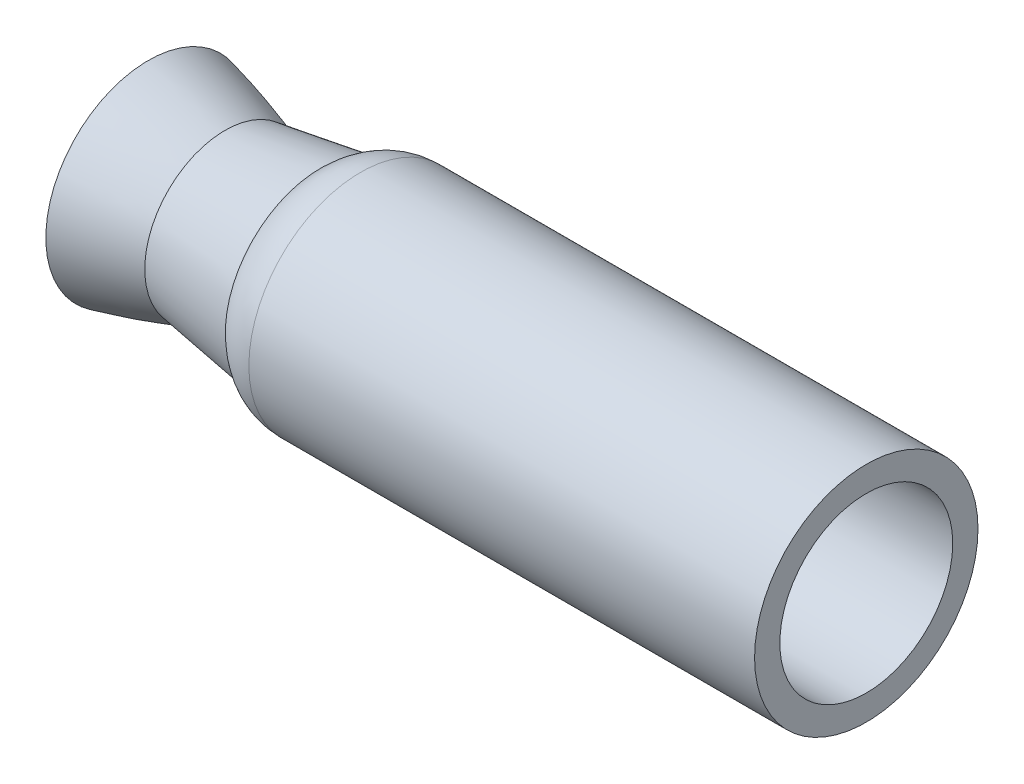
from build123d import *


with BuildPart() as part:
    # Sketch1 → Revolve1 (revolve)
    with BuildSketch(Plane.XY):
        with BuildLine():
            Line((28.949236933, 27.386004017), (189.133015331, 27.386004017))
            Line((189.133015331, 27.386004017), (189.133015331, 35.386004017))
            Line((189.133015331, 35.386004017), (28.949236933, 35.386004017))
            ThreePointArc((28.949236933, 35.386004017), (22.060935151, 34.015835602), (16.221314872, 30.113926078))
            Line((16.221314872, 30.113926078), (-13.981586934, 25.437652311))
            add(Edge.make_bspline(
                [(-13.981586934, 25.437652311), (-16.029314719, 26.139512712), (-28.160190772, 30.070121673), (-38.315022829, 32.432092239)],
                knots=[0.414468937, 0.414468937, 0.414468937, 0.513462719, 1, 1, 1], degree=2))
            Line((-38.315022829, 32.432092239), (-40.127010283, 24.64))
            add(Edge.make_bspline(
                [(0, 11.536137468), (-19.948257354, 19.947595697), (-40.127010283, 24.64)],
                knots=[0, 0, 0, 1, 1, 1], degree=2))
            ThreePointArc((0, 11.536137468), (0.81433228, 11.284876268), (1.662309445, 11.2))
            ThreePointArc((1.662309445, 11.2), (8.091391109, 12.478823854), (13.541703369, 16.120606076))
            Line((13.541703369, 16.120606076), (21.878169121, 24.457071829))
            ThreePointArc((21.878169121, 24.457071829), (25.12240261, 26.624799342), (28.949236933, 27.386004017))
        make_face()
    revolve(axis=Axis((0, 0, 0), (-1, 0, 0)))


solid = part.part
